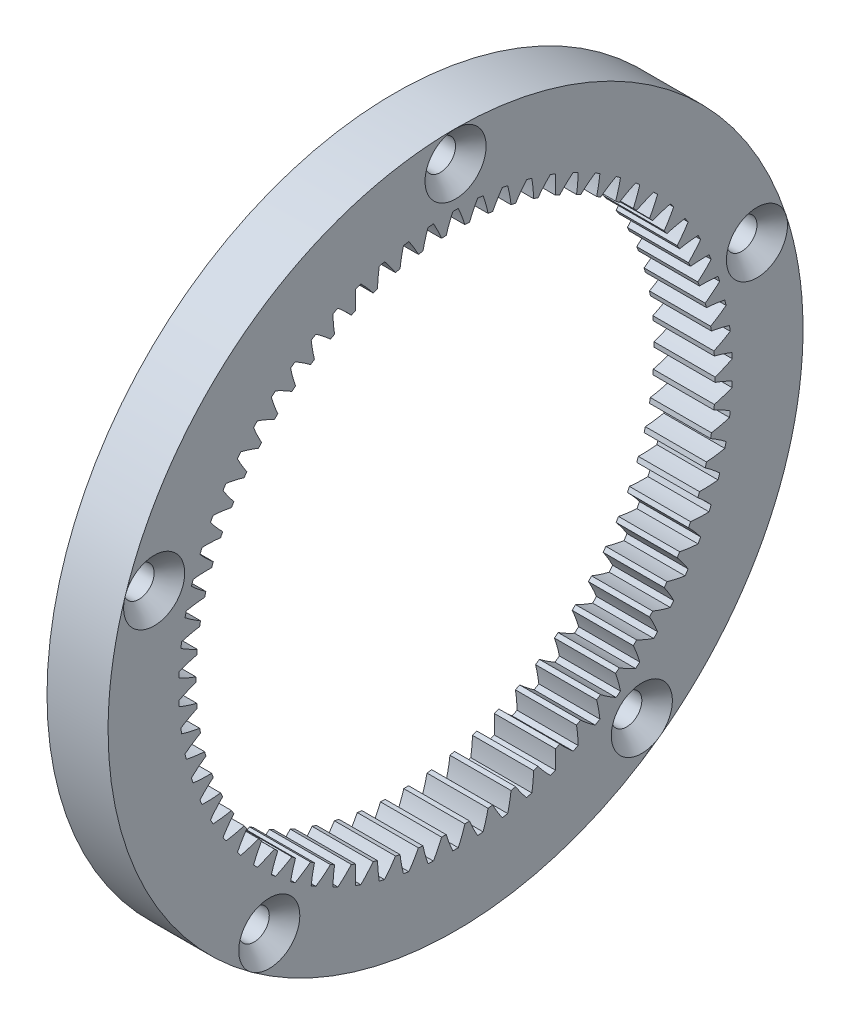
from build123d import *

# Parameters (mm, degrees)
BASPROSKE_W                  = 4
BASPROSKE_H                  = 5.75
TOOTHCUT_DEPTH               = 33.421057972
TEETHCUTS_COUNT              = 70
TEETHCUTS_ANGLE              = 354.857142857
CUT_EXTRUDE1_REACH           = 34.421
SKETCH1_R                    = 1
CHAMFER1_SIZE                = 1
CIRPATTERN2_COUNT            = 5
CHAMFER1_OF_CIRPATTERN2_SIZE = 1


with BuildPart() as part:
    # BasProSke → Base-Revolve (revolve)
    with BuildSketch(Plane(origin=(0, 0, 0), x_dir=(1, 0, 0), z_dir=(0, 1, 0)), mode=Mode.PRIVATE) as base_revolve_sk:
        with Locations((2, 19.875)):
            Rectangle(BASPROSKE_W, BASPROSKE_H)
    revolve(base_revolve_sk.sketch.rotate(Axis((-10, 0, 0), (1, 0, 0)), 180), axis=Axis((-10, 0, 0), (1, 0, 0)))

    # TooCutSke → ToothCut (cut, through all)
    with BuildSketch(Plane(origin=(0, 0, 0), x_dir=(0, 0, -1), z_dir=(1, 0, 0))):
        with BuildLine():
            ThreePointArc((0.616992394, 16.963383081), (0.418702878, 17.552024044), (0.179153089, 18.125114625))
            ThreePointArc((0.179153089, 18.125114625), (0, 18.126), (-0.179153089, 18.125114625))
            ThreePointArc((-0.179153089, 18.125114625), (-0.418702878, 17.552024044), (-0.616992394, 16.963383081))
            ThreePointArc((-0.616992394, 16.963383081), (0, 16.9746), (0.616992394, 16.963383081))
        make_face()
    toothcut = extrude(amount=TOOTHCUT_DEPTH, mode=Mode.SUBTRACT)

    # TeethCuts: ToothCut ×70 about axis
    teethcuts_axis = Axis((-10, 0, 0), (1, 0, 0))
    for i in range(1, TEETHCUTS_COUNT):
        add(toothcut.rotate(teethcuts_axis, i * TEETHCUTS_ANGLE / (TEETHCUTS_COUNT - 1)), mode=Mode.SUBTRACT)

    # Sketch1 → Cut-Extrude1 (cut, up to next)
    with BuildSketch(Plane(origin=(4, 0, 0), x_dir=(0, 0, -1), z_dir=(1, 0, 0)), mode=Mode.PRIVATE) as cut_extrude1_sk1:
        with Locations((0, 20.75)):
            Circle(SKETCH1_R)
    cut_extrude1_tool1 = extrude(cut_extrude1_sk1.sketch, amount=-CUT_EXTRUDE1_REACH, mode=Mode.PRIVATE) & part.part
    cut_extrude1 = cut_extrude1_tool1.solids().sort_by_distance((4, 20.75, 0))[0]
    add(cut_extrude1, mode=Mode.SUBTRACT)

    # Chamfer1
    chamfer1_edges = [part.edges().sort_by_distance(p)[0] for p in [
        (4, 20.75, 1),
    ]]
    chamfer(chamfer1_edges, length=CHAMFER1_SIZE - 0.0001)  # a hair under: the kernel refuses the full size

    # CirPattern2: Cut-Extrude1 ×5 about axis
    cirpattern2_axis = Axis((0, 0, 0), (1, 0, 0))
    for i in range(1, CIRPATTERN2_COUNT):
        add(cut_extrude1.rotate(cirpattern2_axis, i * 360 / CIRPATTERN2_COUNT), mode=Mode.SUBTRACT)

    # Chamfer1 of CirPattern2
    chamfer1_of_cirpattern2_edges = [part.edges().sort_by_distance(p)[0] for p in [
        (4, 5.461046117, 20.043439707),
        (4, -17.374887886, 11.387526991),
        (4, -16.199317381, -13.005560979),
        (4, 7.36315915, -19.425405719),
    ]]
    chamfer(chamfer1_of_cirpattern2_edges, length=CHAMFER1_OF_CIRPATTERN2_SIZE - 0.0001)  # a hair under: the kernel refuses the full size


solid = part.part
